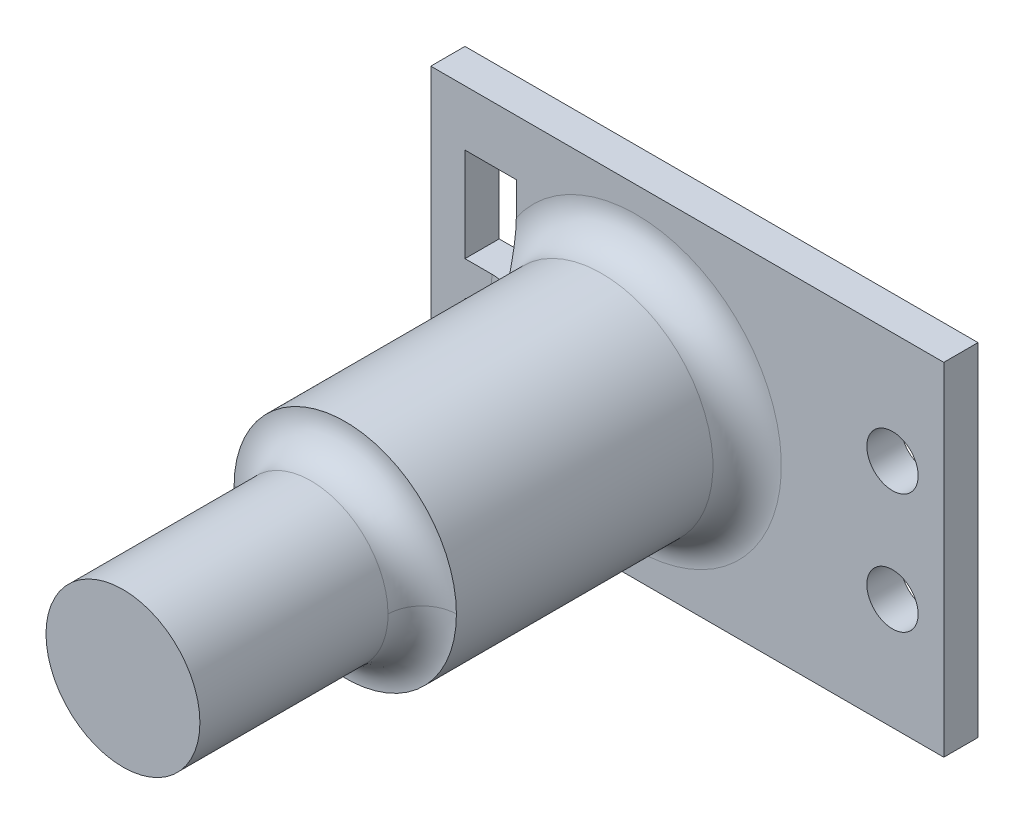
from build123d import *

# Parameters (mm, degrees)
ESQUISSE1_W             = 30
ESQUISSE1_H             = 20
BOSS_EXTRU_1_DEPTH      = 2
ESQUISSE2_R             = 4.5
BOSS_EXTRU_2_DEPTH      = 30
ESQUISSE4_R             = 6.5
BOSS_EXTRU_3_DEPTH      = 17
CONG_1_R                = 2
ESQUISSE5_W             = 3
ESQUISSE5_H             = 5.5
ENL_V_MAT_EXTRU_1_DEPTH = 3
ESQUISSE6_R             = 1.5
ENL_V_MAT_EXTRU_2_DEPTH = 47.904157662


with BuildPart() as part:
    # Esquisse1 → Boss.-Extru.1 (new body)
    with BuildSketch(Plane.XY):
        with Locations((15, 10)):
            Rectangle(ESQUISSE1_W, ESQUISSE1_H)
    extrude(amount=BOSS_EXTRU_1_DEPTH)

    # Esquisse2 → Boss.-Extru.2 (add)
    with BuildSketch(Plane.XY.offset(2)):
        with Locations((12, 9.999053637)):
            Circle(ESQUISSE2_R)
    extrude(amount=BOSS_EXTRU_2_DEPTH)

    # Esquisse4 → Boss.-Extru.3 (add)
    with BuildSketch(Plane.XY.offset(2)):
        with Locations((12, 10)):
            Circle(ESQUISSE4_R)
    extrude(amount=BOSS_EXTRU_3_DEPTH)

    # Congé1
    cong_1_edges = [part.edges().sort_by_distance(p)[0] for p in [
        (7.5, 9.999053637, 19),
        (5.5, 10, 2),
    ]]
    fillet(cong_1_edges, radius=CONG_1_R)

    # Esquisse5 → Enlèv. mat.-Extru.1 (cut)
    with BuildSketch(Plane(origin=(0, 0, 0), x_dir=(-1, 0, 0), z_dir=(0, 0, -1))):
        with Locations((-3.5, 14)):
            Rectangle(ESQUISSE5_W, ESQUISSE5_H)
        with Locations((-3.5, 6.5)):
            Rectangle(ESQUISSE5_W, ESQUISSE5_H)
    extrude(amount=-ENL_V_MAT_EXTRU_1_DEPTH, mode=Mode.SUBTRACT)

    # Esquisse6 → Enlèv. mat.-Extru.2 (cut, through all)
    with BuildSketch(Plane.XY.offset(2)):
        with Locations((27, 13.5)):
            Circle(ESQUISSE6_R)
        with Locations((27, 6.5)):
            Circle(ESQUISSE6_R)
    extrude(amount=-ENL_V_MAT_EXTRU_2_DEPTH, mode=Mode.SUBTRACT)


solid = part.part
